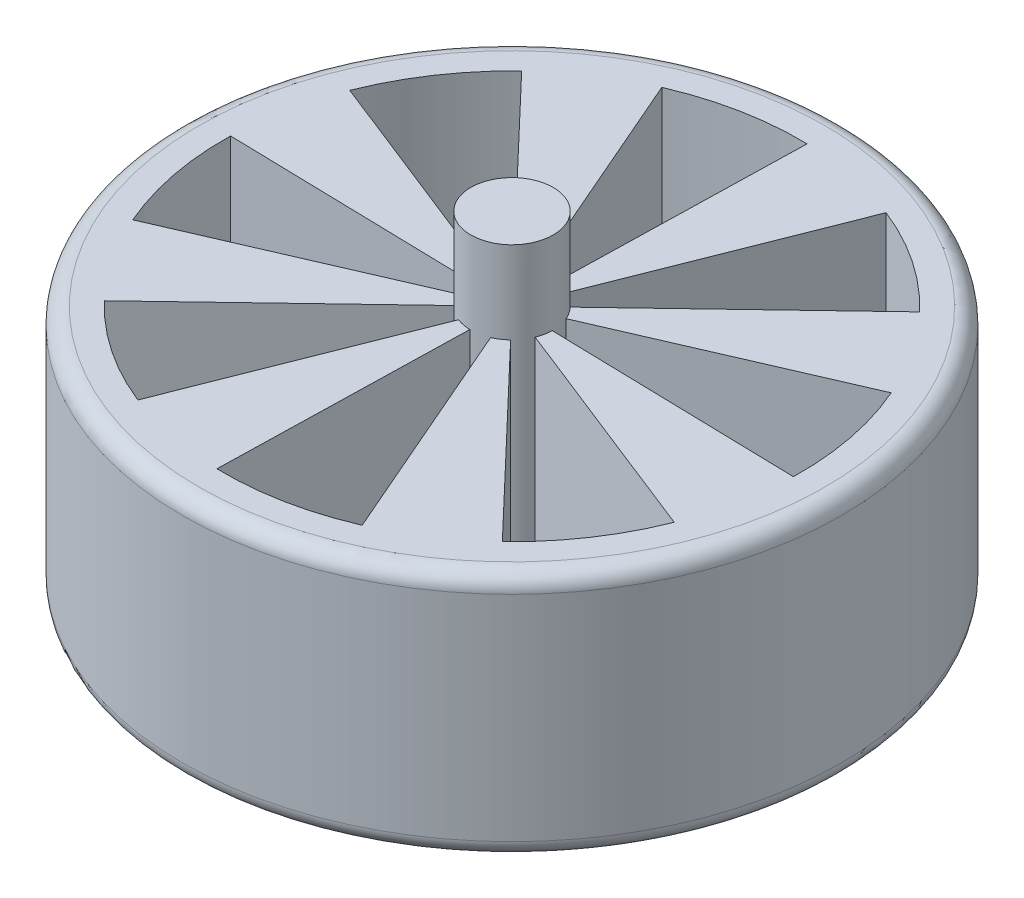
from build123d import *
from build123d.topology import SkipClean

# Parameters (mm, degrees)
SKETCH2_R           = 101.6
BOSS_EXTRUDE1_DEPTH = 76.2
SKETCH4_R           = 12.7
BOSS_EXTRUDE4_DEPTH = 25.4
FILLET1_R           = 5.08
FILLET2_R           = 5.08
CUT_EXTRUDE2_START  = -76.2
CUT_EXTRUDE2_DEPTH  = 76.2
BOSS_EXTRUDE5_START = 25.4
SKETCH8_R           = 12.7
BOSS_EXTRUDE5_DEPTH = 25.4


with BuildPart() as part:
    # Sketch2 → Boss-Extrude1 (new body)
    with BuildSketch(Plane(origin=(0, 0, 0), x_dir=(1, 0, 0), z_dir=(0, 1, 0))):
        Circle(SKETCH2_R)
    extrude(amount=BOSS_EXTRUDE1_DEPTH)

    # Sketch4 → Boss-Extrude4 (add)
    with BuildSketch(Plane(origin=(0, 0, 0), x_dir=(-1, 0, 0), z_dir=(0, -1, 0))):
        Circle(SKETCH4_R)
    extrude(amount=BOSS_EXTRUDE4_DEPTH)

    # Fillet1
    fillet1_edges = [part.edges().sort_by_distance(p)[0] for p in [
        (-101.6, 76.2, 0),
    ]]
    fillet(fillet1_edges, radius=FILLET1_R)

    # Fillet2
    fillet2_edges = [part.edges().sort_by_distance(p)[0] for p in [
        (-101.6, 0, 0),
    ]]
    fillet(fillet2_edges, radius=FILLET2_R)

    # Sketch7 → Cut-Extrude2 (cut)
    with SkipClean():  # the faces are left unmerged after this step: merging them gives an invalid solid
        with BuildSketch(Plane.XZ.offset(CUT_EXTRUDE2_START)):
            with BuildLine():
                ThreePointArc((12.696427962, 0.301192634), (12.464886183, -2.432408777), (11.651702143, -5.052508009))
                Line((11.651702143, -5.052508009), (81.561914999, -35.367556061))
                ThreePointArc((81.561914999, -35.367556061), (87.254203278, -17.026861437), (88.874995735, 2.108348439))
                Line((88.874995735, 2.108348439), (12.696427962, 0.301192634))
            make_face()
            with BuildLine():
                Line((64.33493964, -61.353284684), (9.190705663, -8.764754955))
                ThreePointArc((9.190705663, -8.764754955), (7.094032806, -10.533978287), (4.666334922, -11.811660272))
                Line((4.666334922, -11.811660272), (32.664344457, -82.681621907))
                ThreePointArc((32.664344457, -82.681621907), (49.658229641, -73.737848009), (64.33493964, -61.353284684))
            make_face()
            with BuildLine():
                Line((2.108348439, -88.874995735), (0.301192634, -12.696427962))
                ThreePointArc((0.301192634, -12.696427962), (-2.432408777, -12.464886183), (-5.052508009, -11.651702143))
                Line((-5.052508009, -11.651702143), (-35.367556061, -81.561914999))
                ThreePointArc((-35.367556061, -81.561914999), (-17.026861437, -87.254203278), (2.108348439, -88.874995735))
            make_face()
            with BuildLine():
                Line((-61.353284684, -64.33493964), (-8.764754955, -9.190705663))
                ThreePointArc((-8.764754955, -9.190705663), (-10.533978287, -7.094032806), (-11.811660272, -4.666334922))
                Line((-11.811660272, -4.666334922), (-82.681621907, -32.664344457))
                ThreePointArc((-82.681621907, -32.664344457), (-73.737848009, -49.658229641), (-61.353284684, -64.33493964))
            make_face()
            with BuildLine():
                Line((-88.874995735, -2.108348439), (-12.696427962, -0.301192634))
                ThreePointArc((-12.696427962, -0.301192634), (-12.464886183, 2.432408777), (-11.651702143, 5.052508009))
                Line((-11.651702143, 5.052508009), (-81.561914999, 35.367556061))
                ThreePointArc((-81.561914999, 35.367556061), (-87.254203278, 17.026861437), (-88.874995735, -2.108348439))
            make_face()
            with BuildLine():
                Line((-64.33493964, 61.353284684), (-9.190705663, 8.764754955))
                ThreePointArc((-9.190705663, 8.764754955), (-7.094032806, 10.533978287), (-4.666334922, 11.811660272))
                Line((-4.666334922, 11.811660272), (-32.664344457, 82.681621907))
                ThreePointArc((-32.664344457, 82.681621907), (-49.658229641, 73.737848009), (-64.33493964, 61.353284684))
            make_face()
            with BuildLine():
                Line((-2.108348439, 88.874995735), (-0.301192634, 12.696427962))
                ThreePointArc((-0.301192634, 12.696427962), (2.432408777, 12.464886183), (5.052508009, 11.651702143))
                Line((5.052508009, 11.651702143), (35.367556061, 81.561914999))
                ThreePointArc((35.367556061, 81.561914999), (17.026861437, 87.254203278), (-2.108348439, 88.874995735))
            make_face()
            with BuildLine():
                Line((61.353284684, 64.33493964), (8.764754955, 9.190705663))
                ThreePointArc((8.764754955, 9.190705663), (10.533978287, 7.094032806), (11.811660272, 4.666334922))
                Line((11.811660272, 4.666334922), (82.681621907, 32.664344457))
                ThreePointArc((82.681621907, 32.664344457), (73.737848009, 49.658229641), (61.353284684, 64.33493964))
            make_face()
        extrude(amount=CUT_EXTRUDE2_DEPTH, mode=Mode.SUBTRACT)

    # Sketch8 → Boss-Extrude5 (add)
    with SkipClean():  # the faces are left unmerged after this step: merging them gives an invalid solid
        with BuildSketch(Plane(origin=(0, 76.2, 0), x_dir=(1, 0, 0), z_dir=(0, 1, 0)).offset(BOSS_EXTRUDE5_START)):
            Circle(SKETCH8_R)
        extrude(amount=-BOSS_EXTRUDE5_DEPTH)


solid = part.part
